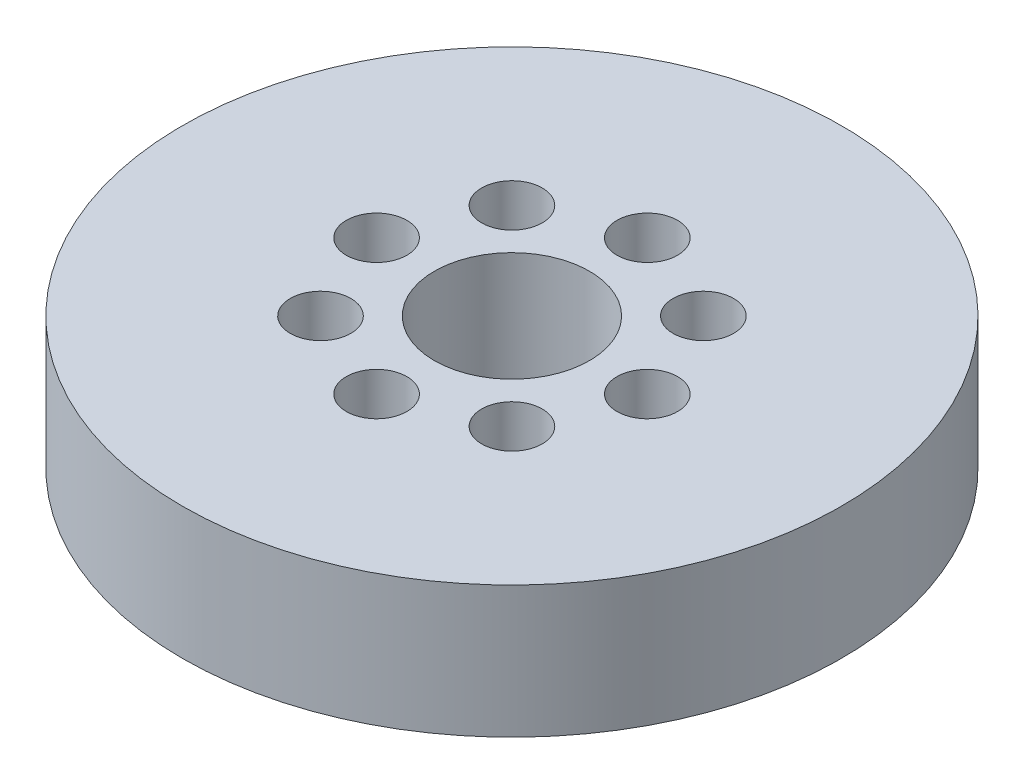
from build123d import *

# Parameters (mm, degrees)
SKETCH1_R           = 42.5
BOSS_EXTRUDE1_DEPTH = 17
SKETCH2_R           = 10
CUT_EXTRUDE1_DEPTH  = 63.461988441
SKETCH3_R           = 3.907317334
CUT_EXTRUDE2_DEPTH  = 11.959066534
CIRPATTERN1_COUNT   = 8


with BuildPart() as part:
    # Sketch1 → Boss-Extrude1 (new body)
    with BuildSketch(Plane(origin=(0, 0, 0), x_dir=(1, 0, 0), z_dir=(0, 1, 0))):
        Circle(SKETCH1_R)
    extrude(amount=BOSS_EXTRUDE1_DEPTH)

    # Sketch2 → Cut-Extrude1 (cut, through all)
    with BuildSketch(Plane(origin=(0, 0, 0), x_dir=(1, 0, 0), z_dir=(0, 1, 0))):
        Circle(SKETCH2_R)
    extrude(amount=CUT_EXTRUDE1_DEPTH, mode=Mode.SUBTRACT)

    # Sketch3 → Cut-Extrude2 (cut)
    with BuildSketch(Plane(origin=(0, 17, 0), x_dir=(1, 0, 0), z_dir=(0, 1, 0))):
        with Locations((-17.454119994, 0)):
            Circle(SKETCH3_R)
    cut_extrude2 = extrude(amount=-CUT_EXTRUDE2_DEPTH, mode=Mode.SUBTRACT)

    # CirPattern1: Cut-Extrude2 ×8 about axis
    cirpattern1_axis = Axis((0, 0, 0), (0, 1, 0))
    for i in range(1, CIRPATTERN1_COUNT):
        add(cut_extrude2.rotate(cirpattern1_axis, i * 360 / CIRPATTERN1_COUNT), mode=Mode.SUBTRACT)


solid = part.part
